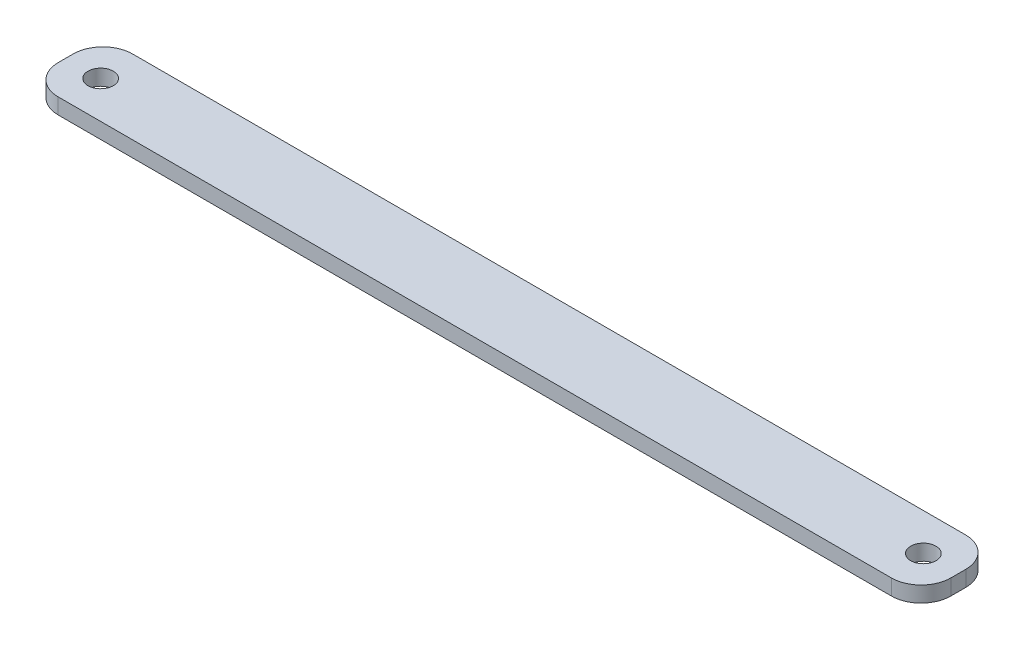
from build123d import *

# Parameters (mm, degrees)
CROQUIS1_W              = 120
CROQUIS1_H              = 10
CROQUIS1_R              = 1.7
SALIENTE_EXTRUIR1_DEPTH = 2.11
REDONDEO1_R             = 4


with BuildPart() as part:
    # Croquis1 → Saliente-Extruir1 (new body)
    with BuildSketch(Plane(origin=(0, 0, 0), x_dir=(1, 0, 0), z_dir=(0, 1, 0))):
        Rectangle(CROQUIS1_W, CROQUIS1_H)
        with Locations((-55.3, 0)):
            Circle(CROQUIS1_R, mode=Mode.SUBTRACT)
        with Locations((55.3, 0)):
            Circle(CROQUIS1_R, mode=Mode.SUBTRACT)
    extrude(amount=SALIENTE_EXTRUIR1_DEPTH)

    # Redondeo1
    redondeo1_edges = [part.edges().sort_by_distance(p)[0] for p in [
        (60, 1.055, -5),
        (60, 1.055, 5),
        (-60, 1.055, -5),
        (-60, 1.055, 5),
    ]]
    fillet(redondeo1_edges, radius=REDONDEO1_R)


solid = part.part
